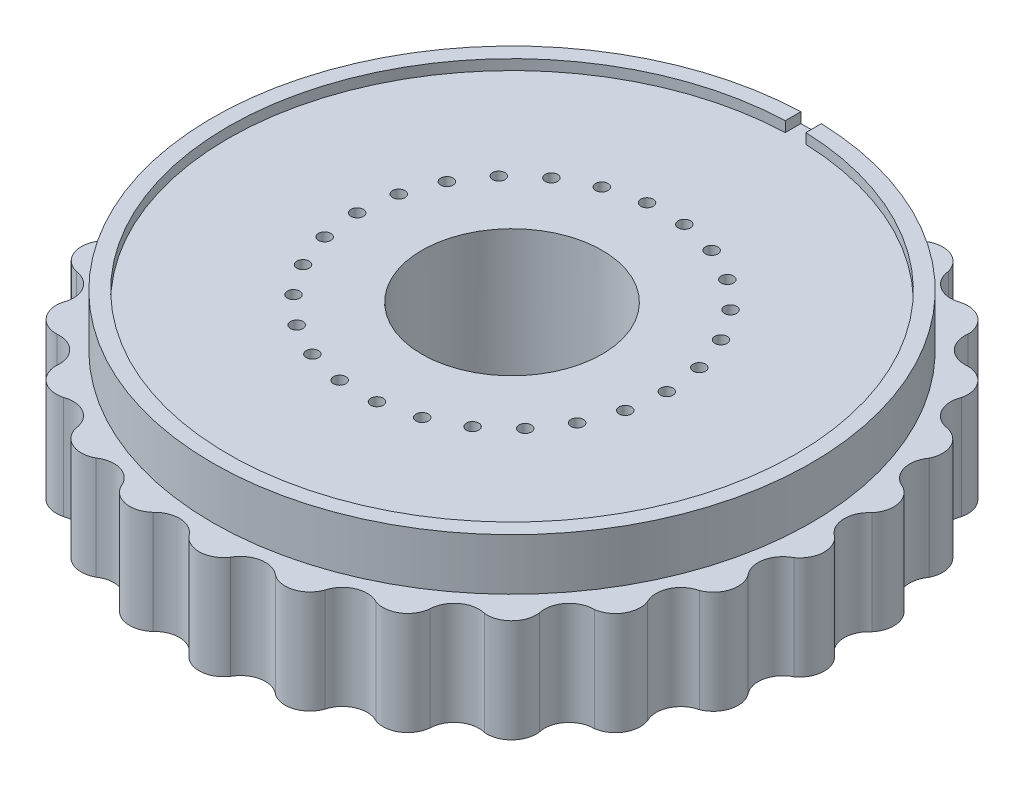
from build123d import *

# Parameters (mm, degrees)
EXTRUDE_WHEEL_DEPTH        = 10
CIRPATTERN1_COUNT          = 26
SKETCH4_R                  = 29
BOSS_EXTRUDE1_DEPTH        = 5
BEARING_HOLE_R             = 8.73125
CUT_BEARING_HOLE_DEPTH     = 48.798947189
PCB_INSET_CUT_DEPTH        = 1
PCB_START                  = -1
PCB_INSET_CUT_2_DEPTH      = 1
PCB_OUTPUT_HOLES_R         = 0.6
PCB_OUTPUT_HOLES_CUT_DEPTH = 48.494624458


with BuildPart() as part:
    # Wheel → Extrude wheel (new body)
    with BuildSketch(Plane(origin=(0, 0, 0), x_dir=(1, 0, 0), z_dir=(0, 1, 0))):
        with BuildLine():
            Line((0, 0), (29.128254523, 7.179469929))
            Line((29.128254523, 7.179469929), (30.341931795, 7.478614509))
            ThreePointArc((30.341931795, 7.478614509), (31.616410176, 5.808198613), (31.087663821, 3.774725795))
            ThreePointArc((31.087663821, 3.774725795), (30.249976155, 1.847846509), (31.25, 0))
            Line((31.25, 0), (30, 0))
            Line((30, 0), (0, 0))
        make_face()
    extrude_wheel = extrude(amount=EXTRUDE_WHEEL_DEPTH)

    # CirPattern1: Extrude wheel ×26 about axis
    cirpattern1_axis = Axis((0, 10, 0), (0, -1, 0))
    for i in range(1, CIRPATTERN1_COUNT):
        add(extrude_wheel.rotate(cirpattern1_axis, i * 360 / CIRPATTERN1_COUNT))

    # Sketch4 → Boss-Extrude1 (add)
    with BuildSketch(Plane(origin=(0, 10, 0), x_dir=(1, 0, 0), z_dir=(0, 1, 0))):
        Circle(SKETCH4_R)
    extrude(amount=BOSS_EXTRUDE1_DEPTH)

    # Bearing hole → Cut bearing hole (cut, through all)
    with BuildSketch(Plane(origin=(0, 15, 0), x_dir=(1, 0, 0), z_dir=(0, 1, 0))):
        Circle(BEARING_HOLE_R)
    extrude(amount=-CUT_BEARING_HOLE_DEPTH, mode=Mode.SUBTRACT)

    # PCB inset → PCB inset cut (cut)
    with BuildSketch(Plane(origin=(0, 15, 0), x_dir=(1, 0, 0), z_dir=(0, 1, 0))):
        with BuildLine():
            Line((-1, 27.481812167), (-1, 29.481812167))
            Line((-1, 29.481812167), (1, 29.481812167))
            Line((1, 29.481812167), (1, 27.481812167))
            ThreePointArc((1, 27.481812167), (0, -27.5), (-1, 27.481812167))
        make_face()
    extrude(amount=-PCB_INSET_CUT_DEPTH, mode=Mode.SUBTRACT)

    # PCB inset 2 → PCB inset cut 2 (cut)
    with BuildSketch(Plane.XZ.offset(PCB_START)):
        with BuildLine():
            Line((1, -27.481812167), (1, -29.481812167))
            Line((1, -29.481812167), (-1, -29.481812167))
            Line((-1, -29.481812167), (-1, -27.481812167))
            ThreePointArc((-1, -27.481812167), (0, 27.5), (1, -27.481812167))
        make_face()
    extrude(amount=PCB_INSET_CUT_2_DEPTH, mode=Mode.SUBTRACT)

    # PCB output holes → PCB output holes cut (cut, through all)
    with BuildSketch(Plane(origin=(0, 14, 0), x_dir=(1, 0, 0), z_dir=(0, 1, 0))):
        with Locations((15, 0)):
            Circle(PCB_OUTPUT_HOLES_R)
        with Locations((14.564127261, -3.589734964)):
            Circle(PCB_OUTPUT_HOLES_R)
        with Locations((13.281840385, -6.970847581)):
            Circle(PCB_OUTPUT_HOLES_R)
        with Locations((11.227661223, -9.946839874)):
            Circle(PCB_OUTPUT_HOLES_R)
        with Locations((8.520971201, -12.344757988)):
            Circle(PCB_OUTPUT_HOLES_R)
        with Locations((5.319073306, -14.02524364)):
            Circle(PCB_OUTPUT_HOLES_R)
        with Locations((1.808050204, -14.890633111)):
            Circle(PCB_OUTPUT_HOLES_R)
        with Locations((-1.808050204, -14.890633111)):
            Circle(PCB_OUTPUT_HOLES_R)
        with Locations((-5.319073306, -14.02524364)):
            Circle(PCB_OUTPUT_HOLES_R)
        with Locations((-8.520971201, -12.344757988)):
            Circle(PCB_OUTPUT_HOLES_R)
        with Locations((-11.227661223, -9.946839874)):
            Circle(PCB_OUTPUT_HOLES_R)
        with Locations((-13.281840385, -6.970847581)):
            Circle(PCB_OUTPUT_HOLES_R)
        with Locations((-14.564127261, -3.589734964)):
            Circle(PCB_OUTPUT_HOLES_R)
        with Locations((-15, 0)):
            Circle(PCB_OUTPUT_HOLES_R)
        with Locations((-14.564127261, 3.589734964)):
            Circle(PCB_OUTPUT_HOLES_R)
        with Locations((-13.281840385, 6.970847581)):
            Circle(PCB_OUTPUT_HOLES_R)
        with Locations((-11.227661223, 9.946839874)):
            Circle(PCB_OUTPUT_HOLES_R)
        with Locations((-8.520971201, 12.344757988)):
            Circle(PCB_OUTPUT_HOLES_R)
        with Locations((-5.319073306, 14.02524364)):
            Circle(PCB_OUTPUT_HOLES_R)
        with Locations((-1.808050204, 14.890633111)):
            Circle(PCB_OUTPUT_HOLES_R)
        with Locations((1.808050204, 14.890633111)):
            Circle(PCB_OUTPUT_HOLES_R)
        with Locations((5.319073306, 14.02524364)):
            Circle(PCB_OUTPUT_HOLES_R)
        with Locations((8.520971201, 12.344757988)):
            Circle(PCB_OUTPUT_HOLES_R)
        with Locations((11.227661223, 9.946839874)):
            Circle(PCB_OUTPUT_HOLES_R)
        with Locations((13.281840385, 6.970847581)):
            Circle(PCB_OUTPUT_HOLES_R)
        with Locations((14.564127261, 3.589734964)):
            Circle(PCB_OUTPUT_HOLES_R)
    extrude(amount=-PCB_OUTPUT_HOLES_CUT_DEPTH, mode=Mode.SUBTRACT)


solid = part.part
